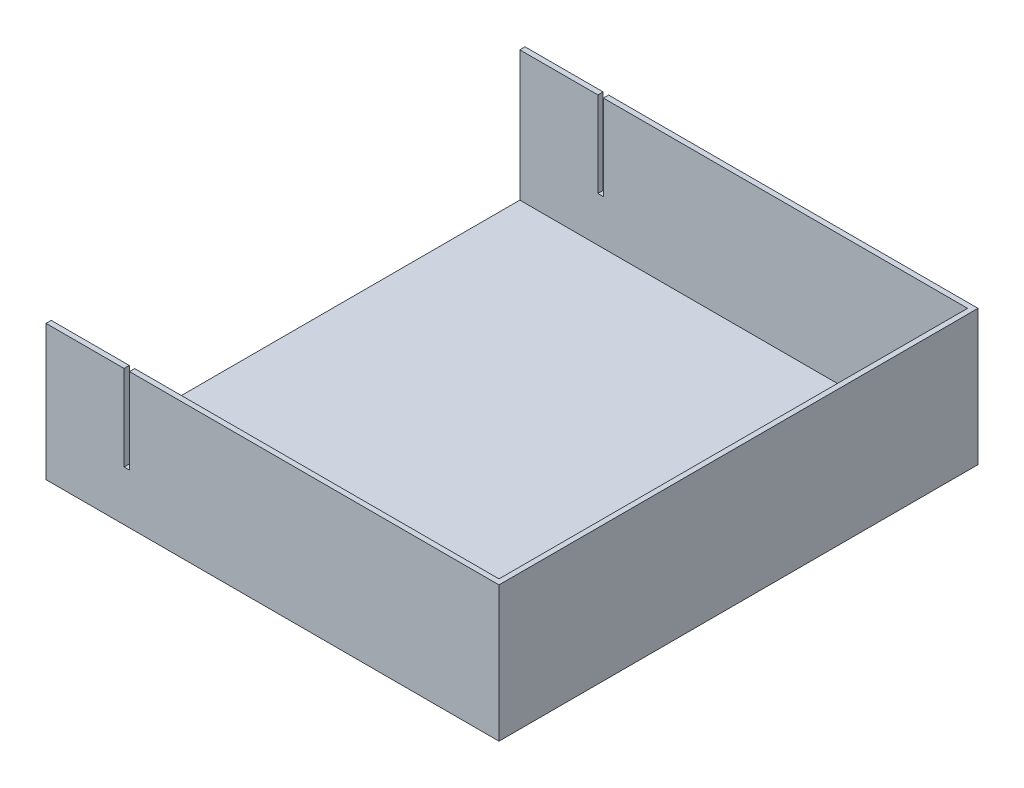
from build123d import *

# Parameters (mm, degrees)
SKETCH1_W           = 279.4
SKETCH1_H           = 292.1
BOSS_EXTRUDE1_DEPTH = 82.55
SKETCH3_W           = 273.05
SKETCH3_H           = 285.75
CUT_EXTRUDE1_DEPTH  = 79.375
CUT_EXTRUDE2_REACH  = 414.555
SKETCH4_W           = 3.175
SKETCH4_H           = 292.1
SKETCH5_W           = 3.302
SKETCH5_H           = 52.07
CUT_EXTRUDE3_DEPTH  = 413.554569118


with BuildPart() as part:
    # Sketch1 → Boss-Extrude1 (new body)
    with BuildSketch(Plane(origin=(0, 0, 0), x_dir=(1, 0, 0), z_dir=(0, 1, 0))):
        with Locations((139.7, 146.05)):
            Rectangle(SKETCH1_W, SKETCH1_H)
    extrude(amount=BOSS_EXTRUDE1_DEPTH)

    # Sketch3 → Cut-Extrude1 (cut)
    with BuildSketch(Plane(origin=(0, 82.55, 0), x_dir=(1, 0, 0), z_dir=(0, 1, 0))):
        with Locations((139.7, 146.05)):
            Rectangle(SKETCH3_W, SKETCH3_H)
    extrude(amount=-CUT_EXTRUDE1_DEPTH, mode=Mode.SUBTRACT)

    # Sketch4 → Cut-Extrude2 (cut, up to next)
    with BuildSketch(Plane(origin=(0, 82.55, 0), x_dir=(1, 0, 0), z_dir=(0, 1, 0)), mode=Mode.PRIVATE) as cut_extrude2_sk1:
        with Locations((1.5875, 146.05)):
            Rectangle(SKETCH4_W, SKETCH4_H)
    cut_extrude2_tool1 = extrude(cut_extrude2_sk1.sketch, amount=-CUT_EXTRUDE2_REACH, mode=Mode.PRIVATE) & part.part
    add(cut_extrude2_tool1.solids().sort_by_distance((1.5875, 82.55, -146.05))[0], mode=Mode.SUBTRACT)

    # Sketch5 → Cut-Extrude3 (cut, through all)
    with BuildSketch(Plane(origin=(0, 0, -292.1), x_dir=(-1, 0, 0), z_dir=(0, 0, -1))):
        with Locations((-52.451, 56.515)):
            Rectangle(SKETCH5_W, SKETCH5_H)
    extrude(amount=-CUT_EXTRUDE3_DEPTH, mode=Mode.SUBTRACT)


solid = part.part
